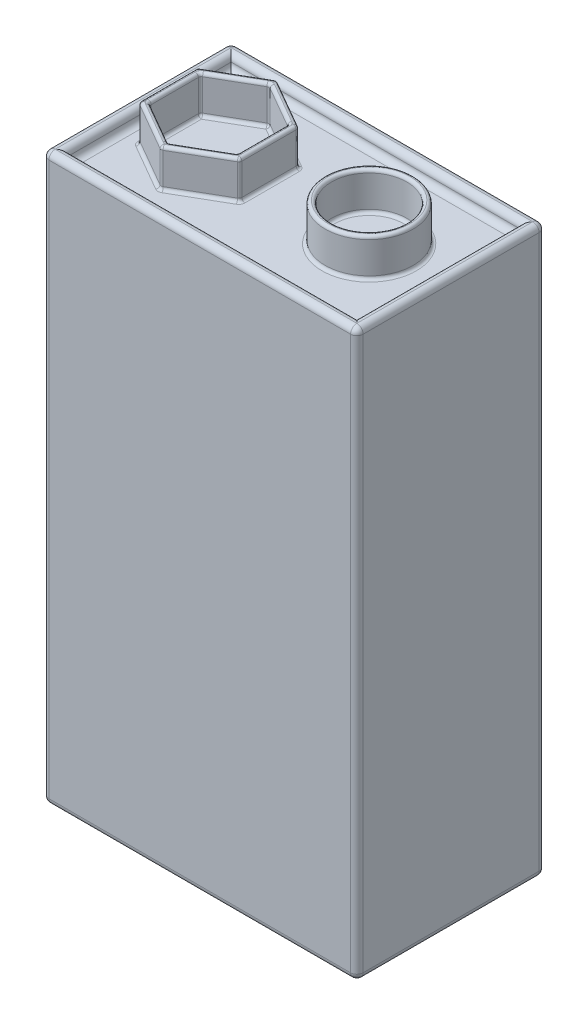
from build123d import *

# Parameters (mm, degrees)
SKETCH1_W           = 25
SKETCH1_H           = 45
BOSS_EXTRUDE1_DEPTH = 15
SKETCH2_W           = 23
SKETCH2_H           = 13
CUT_EXTRUDE1_DEPTH  = 1
SKETCH3_W           = 23
SKETCH3_H           = 13
CUT_EXTRUDE2_DEPTH  = 1
FILLET2_R           = 0.5
SKETCH4_R           = 3.5
SKETCH4_R_2         = 3
BOSS_EXTRUDE2_DEPTH = 3
FILLET3_R           = 0.25


with BuildPart() as part:
    # Sketch1 → Boss-Extrude1 (new body)
    with BuildSketch(Plane.XY):
        Rectangle(SKETCH1_W, SKETCH1_H)
    extrude(amount=BOSS_EXTRUDE1_DEPTH)

    # Sketch2 → Cut-Extrude1 (cut)
    with BuildSketch(Plane(origin=(0, 22.5, 0), x_dir=(1, 0, 0), z_dir=(0, 1, 0))):
        with Locations((0, -7.5)):
            Rectangle(SKETCH2_W, SKETCH2_H)
    extrude(amount=-CUT_EXTRUDE1_DEPTH, mode=Mode.SUBTRACT)

    # Sketch3 → Cut-Extrude2 (cut)
    with BuildSketch(Plane.XZ.offset(22.5)):
        with Locations((0, 7.5)):
            Rectangle(SKETCH3_W, SKETCH3_H)
    extrude(amount=-CUT_EXTRUDE2_DEPTH, mode=Mode.SUBTRACT)

    # Fillet2
    fillet2_edges = [part.edges().sort_by_distance(p)[0] for p in [
        (12.5, 22.5, 7.5),
        (0, 22.5, 15),
        (-12.5, 22.5, 7.5),
        (0, 22.5, 0),
        (-11.5, 22.5, 7.5),
        (0, 22.5, 14),
        (11.5, 22.5, 7.5),
        (0, 22.5, 1),
        (0, 21.5, 14),
        (-11.5, 21.5, 7.5),
        (0, 21.5, 1),
        (11.5, 21.5, 7.5),
        (-12.5, -22.5, 7.5),
        (0, -22.5, 15),
        (12.5, -22.5, 7.5),
        (0, -22.5, 0),
        (11.5, -22.5, 7.5),
        (0, -22.5, 14),
        (-11.5, -22.5, 7.5),
        (0, -22.5, 1),
        (0, -21.5, 14),
        (11.5, -21.5, 7.5),
        (0, -21.5, 1),
        (-11.5, -21.5, 7.5),
        (12.5, 0, 15),
        (-12.5, 0, 15),
        (-12.5, 0, 0),
        (12.5, 0, 0),
    ]]
    fillet(fillet2_edges, radius=FILLET2_R - 0.0001)  # a hair under: the kernel refuses the full size

    # Sketch4 → Boss-Extrude2 (add)
    # profile 1 of 2: a face of its own
    with BuildSketch(Plane(origin=(0, 21.5, 0), x_dir=(1, 0, 0), z_dir=(0, 1, 0))):
        with Locations(Location((6, -7.520001538, 0), (0, 0, 180))):
            Circle(SKETCH4_R)
        with Locations(Location((6, -7.520001538, 0), (0, 0, 180))):
            Circle(SKETCH4_R_2, mode=Mode.SUBTRACT)
    # profile 2 of 2: a face of its own
    with BuildSketch(Plane(origin=(0, 21.5, 0), x_dir=(1, 0, 0), z_dir=(0, 1, 0))):
        Polygon((-6, -12.10794553), (-2, -9.798544453), (-2, -5.179742299), (-6, -2.870341223), (-10, -5.179742299), (-10, -9.798544453), align=None)
        Polygon((-6, -11.530595261), (-2.5, -9.509869318), (-2.5, -5.468417434), (-6, -3.447691492), (-9.5, -5.468417434), (-9.5, -9.509869318), align=None, mode=Mode.SUBTRACT)
    extrude(amount=BOSS_EXTRUDE2_DEPTH)

    # Fillet3
    fillet3_edges = [part.edges().sort_by_distance(p)[0] for p in [
        (-7.75, 21.5, 10.520232289),
        (-4.25, 21.5, 10.520232289),
        (-2.5, 21.5, 7.489143376),
        (-4.25, 21.5, 4.458054463),
        (-7.75, 21.5, 4.458054463),
        (-9.5, 21.5, 7.489143376),
        (-6, 23, 11.530595261),
        (-2.5, 23, 9.509869318),
        (-2.5, 23, 5.468417434),
        (-6, 23, 3.447691492),
        (-9.5, 23, 5.468417434),
        (-9.5, 23, 9.509869318),
        (9, 21.5, 7.520001538),
        (9.5, 21.5, 7.520001538),
    ]]
    fillet(fillet3_edges, radius=FILLET3_R)
    fillet3_2_edges = [part.edges().sort_by_distance(p)[0] for p in [
        (-8, 24.5, 10.953244991),
        (-4, 24.5, 10.953244991),
        (-2, 24.5, 7.489143376),
        (-4, 24.5, 4.025041761),
        (-8, 24.5, 4.025041761),
        (-10, 24.5, 7.489143376),
        (-10, 23, 9.798544453),
        (-6, 23, 12.10794553),
        (-2, 23, 9.798544453),
        (-2, 23, 5.179742299),
        (-6, 23, 2.870341223),
        (-10, 23, 5.179742299),
        (9.5, 24.5, 7.520001538),
        (9, 24.5, 7.520001538),
    ]]
    fillet(fillet3_2_edges, radius=FILLET3_R - 0.0001)  # a hair under: the kernel refuses the full size
    fillet3_3_edges = [part.edges().sort_by_distance(p)[0] for p in [
        (-8, 21.5, 10.953244991),
        (-4, 21.5, 10.953244991),
        (-2, 21.5, 7.489143376),
        (-4, 21.5, 4.025041761),
        (-8, 21.5, 4.025041761),
        (-10, 21.5, 7.489143376),
        (-9.966519748, 21.5, 5.199072132),
        (-9.966519748, 21.5, 9.779214621),
        (-6, 21.5, 2.909000887),
        (-2.033480252, 21.5, 5.199072132),
        (-2.033480252, 21.5, 9.779214621),
        (-6, 21.5, 12.069285865),
    ]]
    fillet(fillet3_3_edges, radius=FILLET3_R)
    fillet3_4_edges = [part.edges().sort_by_distance(p)[0] for p in [
        (-7.75, 24.5, 10.520232289),
        (-4.25, 24.5, 10.520232289),
        (-2.5, 24.5, 7.489143376),
        (-4.25, 24.5, 4.458054463),
        (-7.75, 24.5, 4.458054463),
        (-9.5, 24.5, 7.489143376),
        (-9.466506351, 24.5, 5.487755001),
        (-9.466506351, 24.5, 9.490531751),
        (-6, 24.5, 3.486366626),
        (-2.533493649, 24.5, 5.487755001),
        (-2.533493649, 24.5, 9.490531751),
        (-6, 24.5, 11.491920126),
    ]]
    fillet(fillet3_4_edges, radius=FILLET3_R)


solid = part.part
